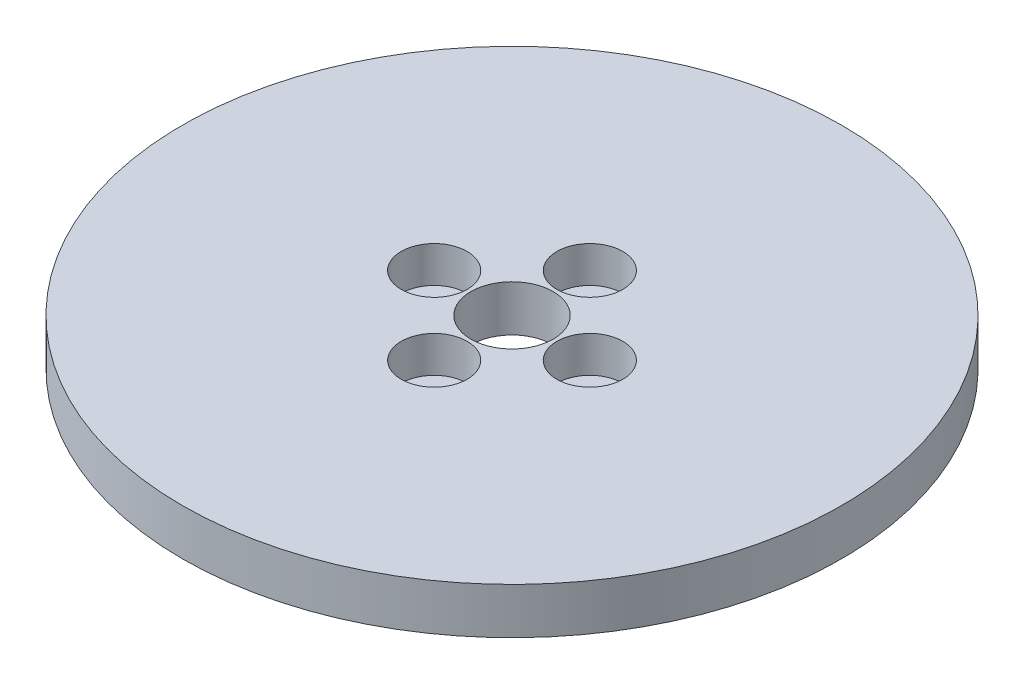
from build123d import *

# Parameters (mm, degrees)
SKETCH1_R           = 100
BOSS_EXTRUDE1_DEPTH = 14
SKETCH2_R           = 12.5
CUT_EXTRUDE1_DEPTH  = 143.112631388
SKETCH3_R           = 10
CUT_EXTRUDE2_DEPTH  = 11.015412359
CIRPATTERN1_COUNT   = 4


with BuildPart() as part:
    # Sketch1 → Boss-Extrude1 (new body)
    with BuildSketch(Plane(origin=(0, 0, 0), x_dir=(1, 0, 0), z_dir=(0, 1, 0))):
        Circle(SKETCH1_R)
    extrude(amount=BOSS_EXTRUDE1_DEPTH)

    # Sketch2 → Cut-Extrude1 (cut, through all)
    with BuildSketch(Plane(origin=(0, 0, 0), x_dir=(1, 0, 0), z_dir=(0, 1, 0))):
        Circle(SKETCH2_R)
    extrude(amount=CUT_EXTRUDE1_DEPTH, mode=Mode.SUBTRACT)

    # Sketch3 → Cut-Extrude2 (cut)
    with BuildSketch(Plane(origin=(0, 14, 0), x_dir=(1, 0, 0), z_dir=(0, 1, 0))):
        with Locations((-23.616715223, 0)):
            Circle(SKETCH3_R)
    cut_extrude2 = extrude(amount=-CUT_EXTRUDE2_DEPTH, mode=Mode.SUBTRACT)

    # CirPattern1: Cut-Extrude2 ×4 about axis
    cirpattern1_axis = Axis((0, 0, 0), (0, 1, 0))
    for i in range(1, CIRPATTERN1_COUNT):
        add(cut_extrude2.rotate(cirpattern1_axis, i * 360 / CIRPATTERN1_COUNT), mode=Mode.SUBTRACT)


solid = part.part
